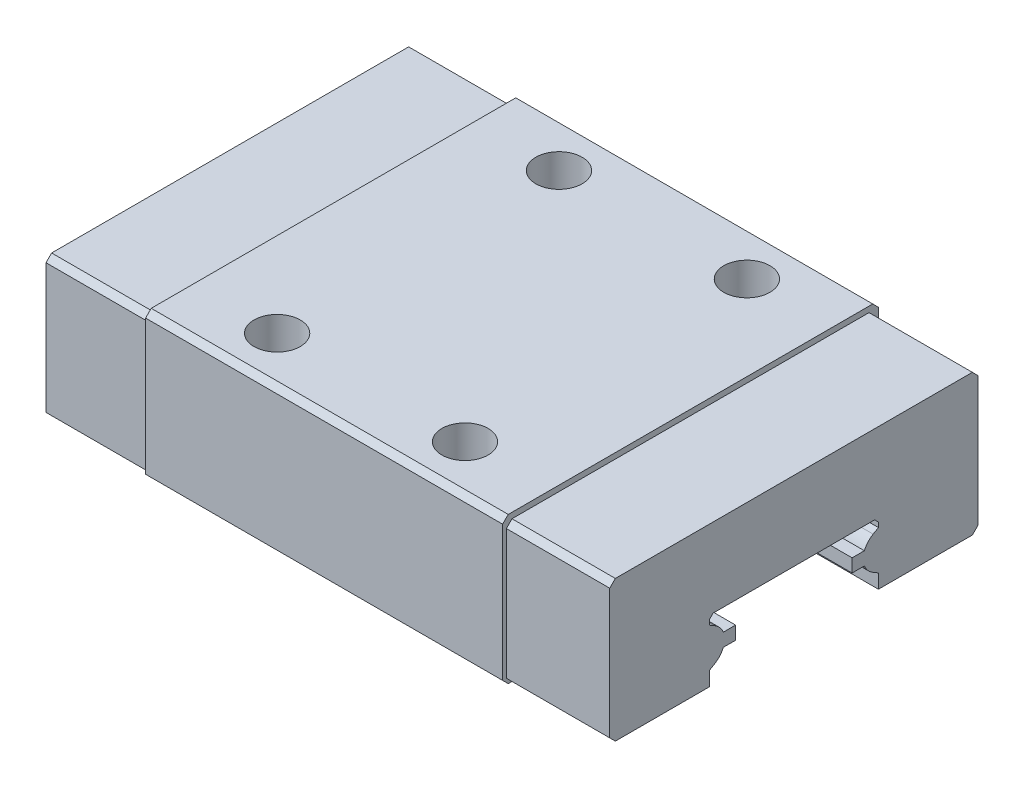
from build123d import *

# Parameters (mm, degrees)
SKETCH1_W               = 19.6
SKETCH1_H               = 7.5
BOSS_EXTRUDE1_DEPTH     = 15
SKETCH2_W               = 20
SKETCH2_H               = 7.8
BOSS_EXTRUDE2_DEPTH     = 9.5
CUT_EXTRUDE2_DEPTH      = 21.615528128
CUT_EXTRUDE2_DEPTH_BACK = 21.615528128
CHAMFER1_SIZE           = 0.3
CHAMFER2_SIZE           = 0.3
CHAMFER3_SIZE           = 0.3
CHAMFER4_SIZE           = 0.3
LPATTERN2_COUNT         = 2
LPATTERN2_PITCH         = 10
LPATTERN2_COUNT_DIR2    = 2
LPATTERN2_PITCH_DIR2    = 15


with BuildPart() as part:
    # Sketch1 → Boss-Extrude1 (new, symmetric)
    with BuildSketch(Plane(origin=(0, 0, 0), x_dir=(0, 0, -1), z_dir=(1, 0, 0))):
        with Locations((0, 5.95)):
            Rectangle(SKETCH1_W, SKETCH1_H)
    extrude(amount=BOSS_EXTRUDE1_DEPTH, both=True)

    # Sketch2 → Boss-Extrude2 (add, symmetric)
    with BuildSketch(Plane(origin=(0, 0, 0), x_dir=(0, 0, -1), z_dir=(1, 0, 0))):
        with Locations((0, 6.1)):
            Rectangle(SKETCH2_W, SKETCH2_H)
    extrude(amount=BOSS_EXTRUDE2_DEPTH, both=True)

    # Sketch4 → Cut-Extrude2 (cut, two sides: drawn at the far end of the back side and taken through both)
    with BuildSketch(Plane(origin=(0, 0, 0), x_dir=(0, 0, -1), z_dir=(1, 0, 0)).offset(-CUT_EXTRUDE2_DEPTH_BACK)):
        with BuildLine():
            Line((-4.3, 5.5), (4.3, 5.5))
            Line((4.3, 5.5), (4.5, 5.3))
            Line((4.5, 5.3), (4.5, 5.04428602))
            Line((4.5, 5.04428602), (4.22, 4.882627944))
            ThreePointArc((4.22, 4.882627944), (3.942636741, 4.654893122), (3.753338798, 4.35))
            Line((3.753338798, 4.35), (3.1, 4.35))
            Line((3.1, 4.35), (3.1, 3.65))
            Line((3.1, 3.65), (3.753338798, 3.65))
            ThreePointArc((3.753338798, 3.65), (3.942636741, 3.345106878), (4.22, 3.117372056))
            Line((4.22, 3.117372056), (4.5, 2.95571398))
            Line((4.5, 2.95571398), (4.5, 0))
            Line((4.5, 0), (-4.5, 0))
            Line((-4.5, 0), (-4.5, 2.95571398))
            Line((-4.5, 2.95571398), (-4.22, 3.117372056))
            ThreePointArc((-4.22, 3.117372056), (-3.942636741, 3.345106878), (-3.753338798, 3.65))
            Line((-3.753338798, 3.65), (-3.1, 3.65))
            Line((-3.1, 3.65), (-3.1, 4.35))
            Line((-3.1, 4.35), (-3.753338798, 4.35))
            ThreePointArc((-3.753338798, 4.35), (-3.942636741, 4.654893122), (-4.22, 4.882627944))
            Line((-4.22, 4.882627944), (-4.5, 5.04428602))
            Line((-4.5, 5.04428602), (-4.5, 5.3))
            Line((-4.5, 5.3), (-4.3, 5.5))
        make_face()
    extrude(amount=CUT_EXTRUDE2_DEPTH + CUT_EXTRUDE2_DEPTH_BACK, mode=Mode.SUBTRACT)

    # Chamfer1
    chamfer1_edges = [part.edges().sort_by_distance(p)[0] for p in [
        (-12.25, 9.7, 9.8),
        (-12.25, 9.7, -9.8),
        (12.25, 9.7, 9.8),
        (12.25, 9.7, -9.8),
    ]]
    chamfer(chamfer1_edges, length=CHAMFER1_SIZE)

    # Chamfer2
    chamfer2_edges = [part.edges().sort_by_distance(p)[0] for p in [
        (0, 10, 10),
        (0, 10, -10),
    ]]
    chamfer(chamfer2_edges, length=CHAMFER2_SIZE)

    # Chamfer3
    chamfer3_edges = [part.edges().sort_by_distance(p)[0] for p in [
        (-12.25, 2.2, -9.8),
        (-12.25, 2.2, 9.8),
        (12.25, 2.2, -9.8),
        (12.25, 2.2, 9.8),
    ]]
    chamfer(chamfer3_edges, length=CHAMFER3_SIZE)

    # Chamfer4
    chamfer4_edges = [part.edges().sort_by_distance(p)[0] for p in [
        (0, 2.2, 10),
        (0, 2.2, -10),
    ]]
    chamfer(chamfer4_edges, length=CHAMFER4_SIZE)

    # Sketch7 → Tap2 (revolve, cut)
    with BuildSketch(Plane(origin=(-5, 10, -7.5), x_dir=(0, 0, 1), z_dir=(1, 0, 0))):
        Polygon((0, 0), (0, 4.738758131), (1.2295, 4), (1.2295, 0), align=None)
    tap2 = revolve(axis=Axis((-5, 10, -7.5), (0, -1, 0)), mode=Mode.SUBTRACT)

    # LPattern2: Tap2 2 × 2
    with Locations(*[(i * LPATTERN2_PITCH, 0, j * LPATTERN2_PITCH_DIR2) for i in range(LPATTERN2_COUNT) for j in range(LPATTERN2_COUNT_DIR2) if (i, j) != (0, 0)]):
        add(tap2, mode=Mode.SUBTRACT)


solid = part.part
